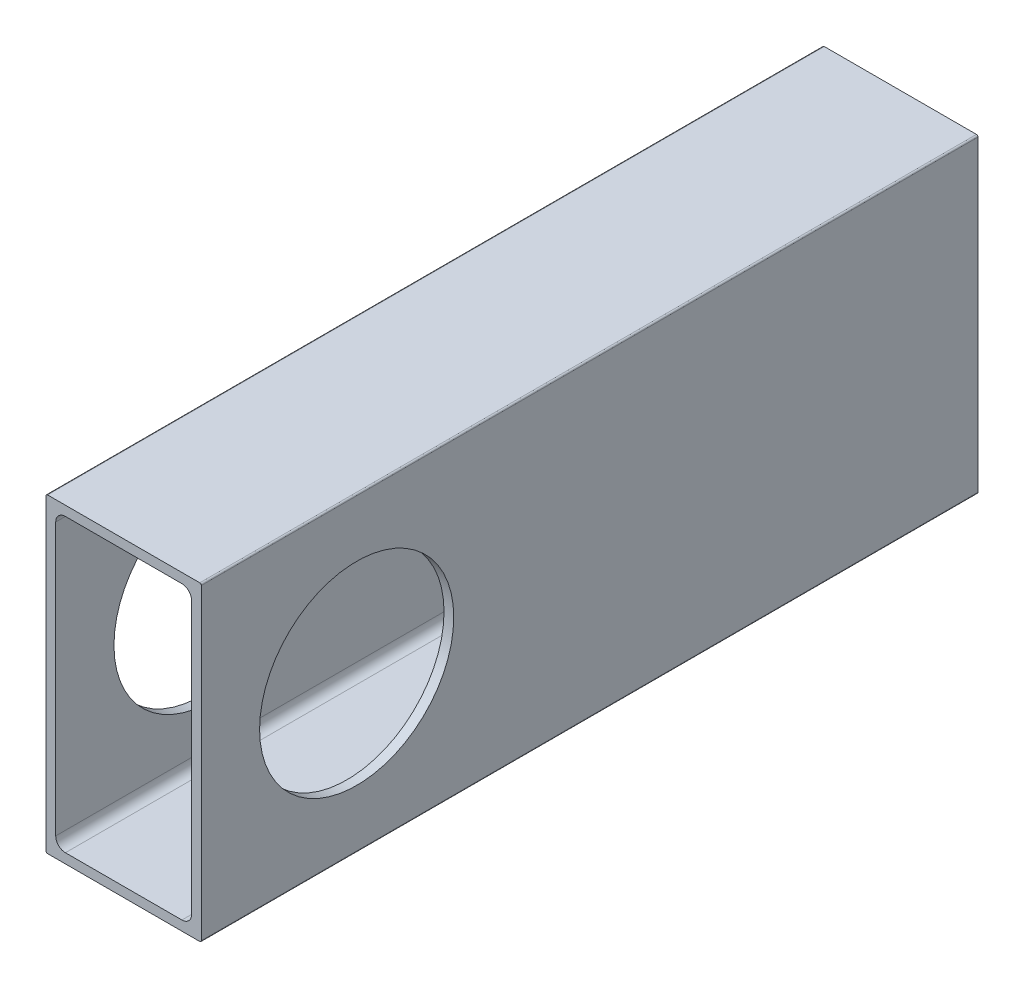
from build123d import *

# Parameters (mm, degrees)
BOSS_EXTRUDE1_DEPTH = 127
SKETCH2_R           = 15.875
CUT_EXTRUDE1_DEPTH  = 25.4


with BuildPart() as part:
    # Sketch1 → Boss-Extrude1 (new body)
    with BuildSketch(Plane(origin=(0, 0, 0), x_dir=(-1, 0, 0), z_dir=(0, 0, -1))):
        with BuildLine():
            Line((-12.7, 25.146), (-12.7, -25.146))
            ThreePointArc((-12.7, -25.146), (-12.625605122, -25.325605122), (-12.446, -25.4))
            Line((-12.446, -25.4), (12.446, -25.4))
            ThreePointArc((12.446, -25.4), (12.625605122, -25.325605122), (12.7, -25.146))
            Line((12.7, -25.146), (12.7, 25.146))
            ThreePointArc((12.7, 25.146), (12.625605122, 25.325605122), (12.446, 25.4))
            Line((12.446, 25.4), (-12.446, 25.4))
            ThreePointArc((-12.446, 25.4), (-12.625605122, 25.325605122), (-12.7, 25.146))
        make_face()
        with BuildLine():
            Line((-11.1125, -22.225), (-11.1125, 22.225))
            ThreePointArc((-11.1125, 22.225), (-10.647532015, 23.347532015), (-9.525, 23.8125))
            Line((-9.525, 23.8125), (9.525, 23.8125))
            ThreePointArc((9.525, 23.8125), (10.647532015, 23.347532015), (11.1125, 22.225))
            Line((11.1125, 22.225), (11.1125, -22.225))
            ThreePointArc((11.1125, -22.225), (10.647532015, -23.347532015), (9.525, -23.8125))
            Line((9.525, -23.8125), (-9.525, -23.8125))
            ThreePointArc((-9.525, -23.8125), (-10.647532015, -23.347532015), (-11.1125, -22.225))
        make_face(mode=Mode.SUBTRACT)
    extrude(amount=-BOSS_EXTRUDE1_DEPTH)

    # Sketch2 → Cut-Extrude1 (cut)
    with BuildSketch(Plane(origin=(12.7, 0, 0), x_dir=(0, 0, -1), z_dir=(1, 0, 0))):
        with Locations((-101.6, 0)):
            Circle(SKETCH2_R)
    extrude(amount=-CUT_EXTRUDE1_DEPTH, mode=Mode.SUBTRACT)


solid = part.part
